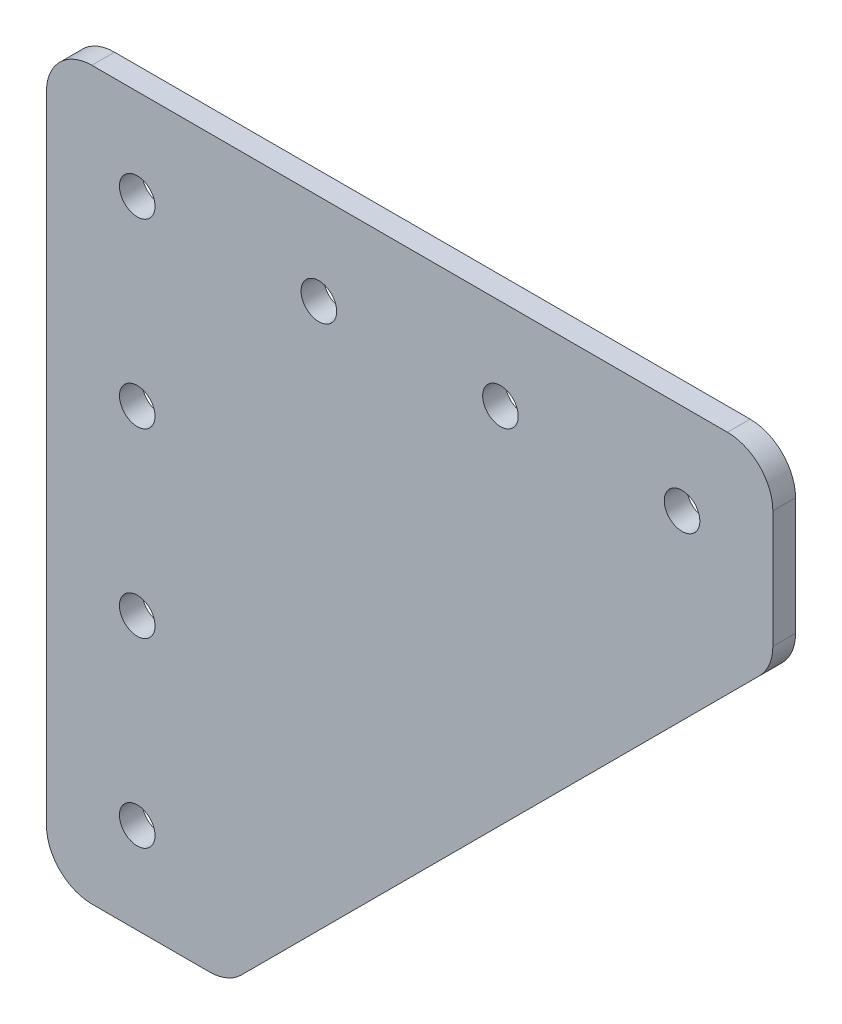
from build123d import *

# Parameters (mm, degrees)
BOSS_EXTRUDE1_DEPTH = 3.175
SKETCH2_R           = 2.4892
CUT_EXTRUDE1_DEPTH  = 144.719172782
FILLET1_R           = 6.35


with BuildPart() as part:
    # Sketch1 → Boss-Extrude1 (new body)
    with BuildSketch(Plane.XY):
        Polygon((0, 0), (0, 101.6), (101.6, 101.6), (101.6, 76.2), (25.4, 0), align=None)
    extrude(amount=BOSS_EXTRUDE1_DEPTH)

    # Sketch2 → Cut-Extrude1 (cut, through all)
    with BuildSketch(Plane.XY.offset(3.175)):
        with Locations((12.7, 88.9)):
            Circle(SKETCH2_R)
        with Locations((38.1, 88.9)):
            Circle(SKETCH2_R)
        with Locations((63.5, 88.9)):
            Circle(SKETCH2_R)
        with Locations((88.9, 88.9)):
            Circle(SKETCH2_R)
        with Locations((12.7, 63.5)):
            Circle(SKETCH2_R)
        with Locations((12.7, 38.1)):
            Circle(SKETCH2_R)
        with Locations((12.7, 12.7)):
            Circle(SKETCH2_R)
    extrude(amount=-CUT_EXTRUDE1_DEPTH, mode=Mode.SUBTRACT)

    # Fillet1
    fillet1_edges = [part.edges().sort_by_distance(p)[0] for p in [
        (25.4, 0, 1.5875),
        (0, 0, 1.5875),
        (0, 101.6, 1.5875),
        (101.6, 76.2, 1.5875),
        (101.6, 101.6, 1.5875),
    ]]
    fillet(fillet1_edges, radius=FILLET1_R)


solid = part.part
